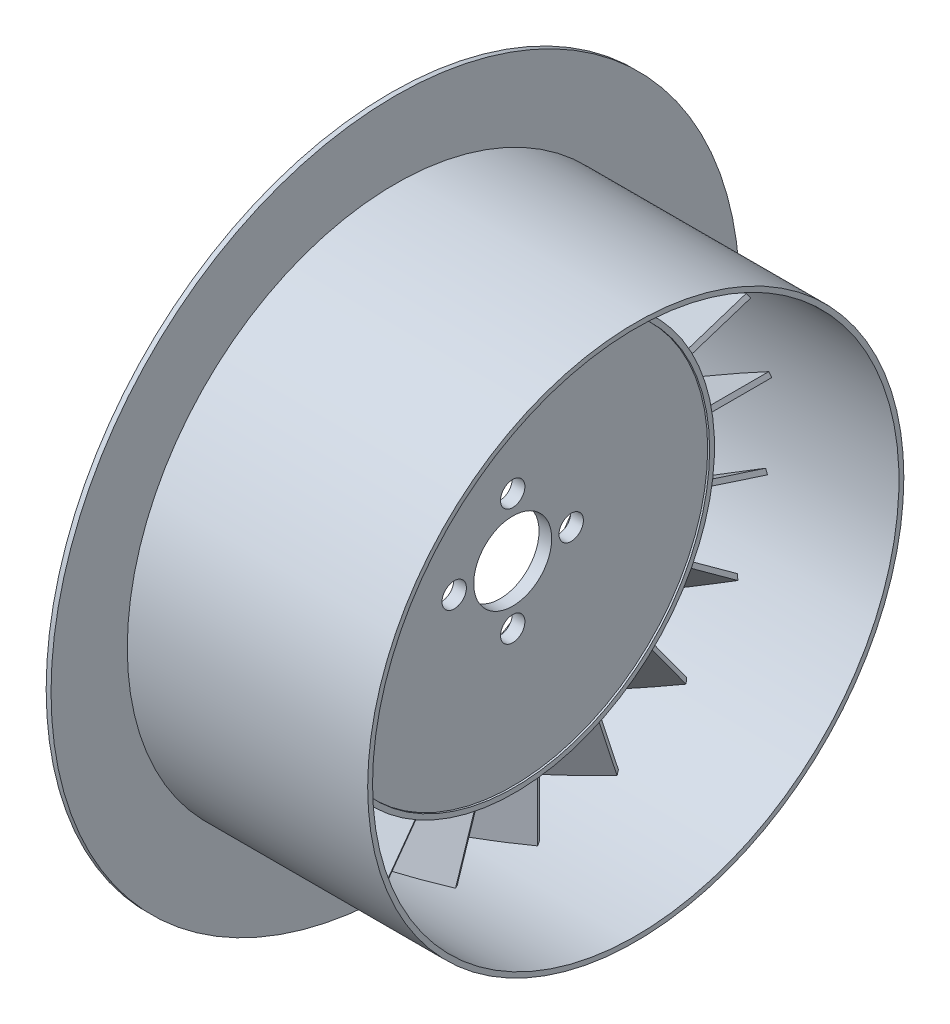
from build123d import *

# Parameters (mm, degrees)
BOSS_EXTRUDE1_REACH        = 166.235
BOSS_EXTRUDE1_START_RADIUS = 52.07
BOSS_EXTRUDE1_END_RADIUS   = 52.07
CIRPATTERN15_COUNT         = 20
SKETCH7_R                  = 3.175
SKETCH7_R_2                = 10.16
CUT_EXTRUDE1_DEPTH         = 102.14463705


with BuildPart() as part:
    # Sketch1 → Revolve1 (revolve)
    with BuildSketch(Plane(origin=(0, 0, 0), x_dir=(1, 0, 0), z_dir=(0, 1, 0))):
        Polygon((3.302, 0), (3.302, 50.8), (3.81, 50.8), (3.81, 52.07), (-25.4, 52.07), (-25.4, 50.8), (0, 50.8), (0, 0), align=None)
    revolve(axis=Axis((0, 0, 0), (1, 0, 0)))

    # Boss-Extrude1: from a cylinder face, 166.235 long prism both ways, kept between that surface and its translate by the depth
    boss_extrude1_start = Plane(origin=(-10.795, 0, 0), z_dir=(-1, 0, 0)) * Cylinder(BOSS_EXTRUDE1_START_RADIUS, 437.61, mode=Mode.PRIVATE)
    boss_extrude1_end = Plane(origin=(-10.795, 0, 16.51), z_dir=(-1, 0, 0)) * Cylinder(BOSS_EXTRUDE1_END_RADIUS, 437.61, mode=Mode.PRIVATE)
    # Sketch2 → Boss-Extrude1 (add, from a surface)
    with BuildSketch(Plane.XY.offset(83.82), mode=Mode.PRIVATE) as boss_extrude1_sk1:
        Polygon((-24.310727154, 7.070073869), (2.085727154, -8.169926131), (2.720727154, -7.070073869), (-23.675727154, 8.169926131), align=None)
    boss_extrude1_tool1 = extrude(boss_extrude1_sk1.sketch, amount=BOSS_EXTRUDE1_REACH, both=True, mode=Mode.PRIVATE)
    boss_extrude1 = ((boss_extrude1_tool1 - boss_extrude1_start) & boss_extrude1_end).solids().sort_by_distance((-25.4, 0, 52.07))[0]
    add(boss_extrude1)

    # CirPattern15: Boss-Extrude1 ×20 about axis
    cirpattern15_axis = Axis((3.81, 0, 0), (-1, 0, 0))
    for i in range(1, CIRPATTERN15_COUNT):
        add(boss_extrude1.rotate(cirpattern15_axis, i * 360 / CIRPATTERN15_COUNT))

    # Sketch7 → Cut-Extrude1 (cut, through all)
    with BuildSketch(Plane(origin=(3.302, 0, 0), x_dir=(0, 0, -1), z_dir=(1, 0, 0))):
        with Locations((0, 15.24)):
            Circle(SKETCH7_R)
        Circle(SKETCH7_R_2)
        with Locations((15.24, 0)):
            Circle(SKETCH7_R)
        with Locations((0, -15.24)):
            Circle(SKETCH7_R)
        with Locations((-15.24, 0)):
            Circle(SKETCH7_R)
    extrude(amount=-CUT_EXTRUDE1_DEPTH, mode=Mode.SUBTRACT)


with BuildPart() as body_2:
    # Sketch8 → Revolve2 (revolve)
    with BuildSketch(Plane.XY):
        Polygon((35.360589781, 69.85), (35.360589781, 68.58), (-28.539332901, 68.58), (-28.539332901, 89.716824123), (-27.269332901, 89.716824123), (-27.269332901, 69.85), align=None)
    revolve(axis=Axis((0, 0, 0), (1, 0, 0)))


solid = Compound([part.part, body_2.part])
